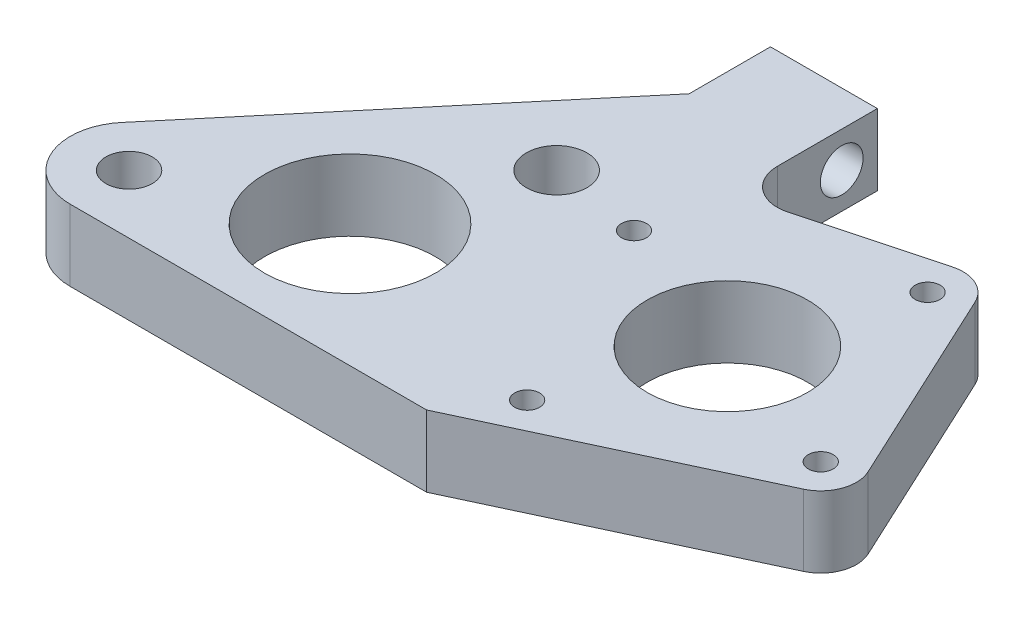
from build123d import *

# Parameters (mm, degrees)
SKETCH1_R           = 3.25
SKETCH1_R_2         = 4.25
SKETCH1_R_3         = 11.25
SKETCH1_R_4         = 1.75
SKETCH1_R_5         = 12
BOSS_EXTRUDE1_DEPTH = 10
FILLET1_R           = 5
CUT_EXTRUDE1_REACH  = 82.843
SKETCH2_R           = 3


with BuildPart() as part:
    # Sketch1 → Boss-Extrude1 (new body)
    with BuildSketch(Plane(origin=(0, 0, 0), x_dir=(1, 0, 0), z_dir=(0, 1, 0))):
        with BuildLine():
            Line((0, -8.25), (50, -8.25))
            Line((50, -8.25), (86.069806885, 8.569627179))
            ThreePointArc((86.069806885, 8.569627179), (88.655178681, 11.391065397), (88.488254512, 15.214257423))
            Line((88.488254512, 15.214257423), (75.387088398, 43.309798821))
            ThreePointArc((75.387088398, 43.309798821), (72.968640771, 45.728246447), (69.561454237, 46.026336644))
            Line((69.561454237, 46.026336644), (45, 39.445114816))
            Line((45, 39.445114816), (45, 60))
            Line((45, 60), (30, 60))
            Line((30, 60), (30, 48.587329349))
            Line((30, 48.587329349), (-6.319866656, 5.30299778))
            ThreePointArc((-6.319866656, 5.30299778), (-7.477039243, -3.486600659), (0, -8.25))
        make_face()
        Circle(SKETCH1_R, mode=Mode.SUBTRACT)
        with Locations((30, 30)):
            Circle(SKETCH1_R_2, mode=Mode.SUBTRACT)
        with Locations((63.358361821, 20.598353756)):
            Circle(SKETCH1_R_3, mode=Mode.SUBTRACT)
        with Locations((42.760008064, 28.095541398)):
            Circle(SKETCH1_R_4, mode=Mode.SUBTRACT)
        with Locations((70.855549463, 41.196707512)):
            Circle(SKETCH1_R_4, mode=Mode.SUBTRACT)
        with Locations((83.956715577, 13.101166114)):
            Circle(SKETCH1_R_4, mode=Mode.SUBTRACT)
        with Locations((55.861174178, 0)):
            Circle(SKETCH1_R_4, mode=Mode.SUBTRACT)
        with Locations((22, 9)):
            Circle(SKETCH1_R_5, mode=Mode.SUBTRACT)
    extrude(amount=BOSS_EXTRUDE1_DEPTH)

    # Fillet1
    fillet1_edges = [part.edges().sort_by_distance(p)[0] for p in [
        (45, 5, -39.445114816),
    ]]
    fillet(fillet1_edges, radius=FILLET1_R)

    # Sketch2 → Cut-Extrude1 (cut, up to next)
    with BuildSketch(Plane(origin=(45, 0, 0), x_dir=(0, 0, -1), z_dir=(1, 0, 0)), mode=Mode.PRIVATE) as cut_extrude1_sk1:
        with Locations((55, 5)):
            Circle(SKETCH2_R)
    cut_extrude1_tool1 = extrude(cut_extrude1_sk1.sketch, amount=-CUT_EXTRUDE1_REACH, mode=Mode.PRIVATE) & part.part
    add(cut_extrude1_tool1.solids().sort_by_distance((45, 5, -55))[0], mode=Mode.SUBTRACT)


solid = part.part
